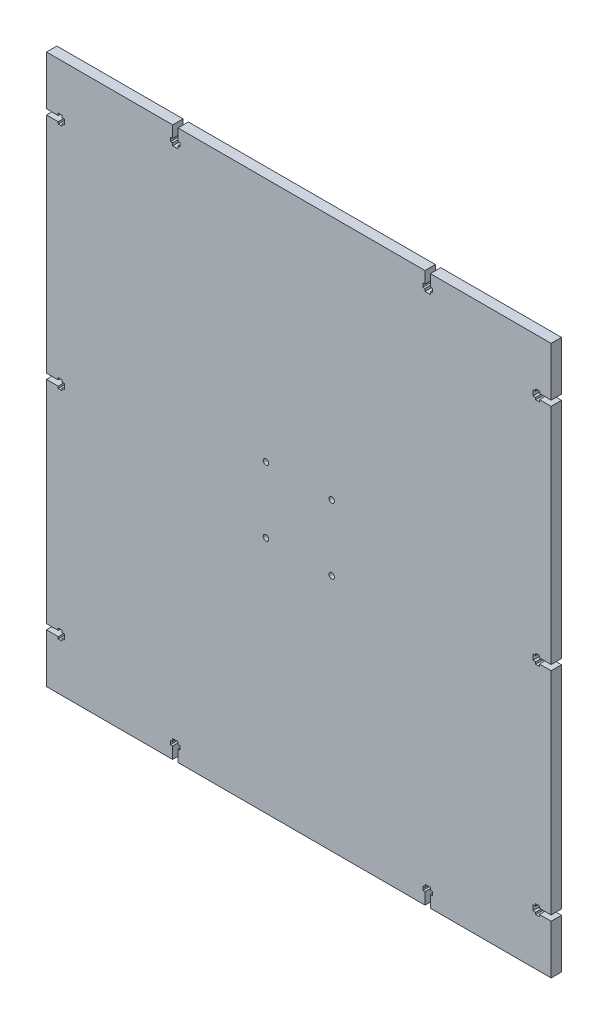
from build123d import *

# Parameters (mm, degrees)
SKETCH_1_R      = 1.6
EXTRUDE_1_DEPTH = 6


with BuildPart() as part:
    # Эскиз1 → Бобышка-Вытянуть1 (new body)
    with BuildSketch(Plane.XY):
        Polygon((0, 0), (73, 0), (73, -6.8), (71.8, -6.8), (71.8, -9), (73, -9), (73, -10.5), (76.1, -10.5), (76.1, -9), (77.3, -9), (77.3, -6.8), (76.1, -6.8), (76.1, 0), (219, 0), (219, -6.8), (217.8, -6.8), (217.8, -9), (219, -9), (219, -10.5), (222.1, -10.5), (222.1, -9), (223.3, -9), (223.3, -6.8), (222.1, -6.8), (222.1, 0), (292, 0), (292, -28.45), (285.2, -28.45), (285.2, -27.25), (283, -27.25), (283, -28.45), (281.5, -28.45), (281.5, -31.55), (283, -31.55), (283, -32.75), (285.2, -32.75), (285.2, -31.55), (292, -31.55), (292, -33.1), (292, -160.95), (285.2, -160.95), (285.2, -159.75), (283, -159.75), (283, -160.95), (281.5, -160.95), (281.5, -164.05), (283, -164.05), (283, -165.25), (285.2, -165.25), (285.2, -164.05), (292, -164.05), (292, -286.45), (285.2, -286.45), (285.2, -285.25), (283, -285.25), (283, -286.45), (281.5, -286.45), (281.5, -289.55), (283, -289.55), (283, -290.75), (285.2, -290.75), (285.2, -289.55), (292, -289.55), (292, -318), (222.1, -318), (222.1, -311.2), (223.3, -311.2), (223.3, -309), (222.1, -309), (222.1, -307.5), (219, -307.5), (219, -309), (217.8, -309), (217.8, -311.2), (219, -311.2), (219, -318), (76.1, -318), (76.1, -311.2), (77.3, -311.2), (77.3, -309), (76.1, -309), (76.1, -307.5), (73, -307.5), (73, -309), (71.8, -309), (71.8, -311.2), (73, -311.2), (73, -318), (0, -318), (0, -289.55), (6.8, -289.55), (6.8, -290.75), (9, -290.75), (9, -289.55), (10.5, -289.55), (10.5, -286.45), (9, -286.45), (9, -285.25), (6.8, -285.25), (6.8, -286.45), (0, -286.45), (0, -164.05), (6.8, -164.05), (6.8, -165.25), (9, -165.25), (9, -164.05), (10.5, -164.05), (10.5, -160.95), (9, -160.95), (9, -159.75), (6.8, -159.75), (6.8, -160.95), (0, -160.95), (0, -31.55), (6.8, -31.55), (6.8, -32.75), (9, -32.75), (9, -31.55), (10.5, -31.55), (10.5, -28.45), (9, -28.45), (9, -27.25), (6.8, -27.25), (6.8, -28.45), (0, -28.45), align=None)
        with Locations((165, -141.95)):
            Circle(SKETCH_1_R, mode=Mode.SUBTRACT)
        with Locations((127, -141.95)):
            Circle(SKETCH_1_R, mode=Mode.SUBTRACT)
        with Locations((165, -179.95)):
            Circle(SKETCH_1_R, mode=Mode.SUBTRACT)
        with Locations((127, -179.95)):
            Circle(SKETCH_1_R, mode=Mode.SUBTRACT)
    extrude(amount=EXTRUDE_1_DEPTH)


solid = part.part
